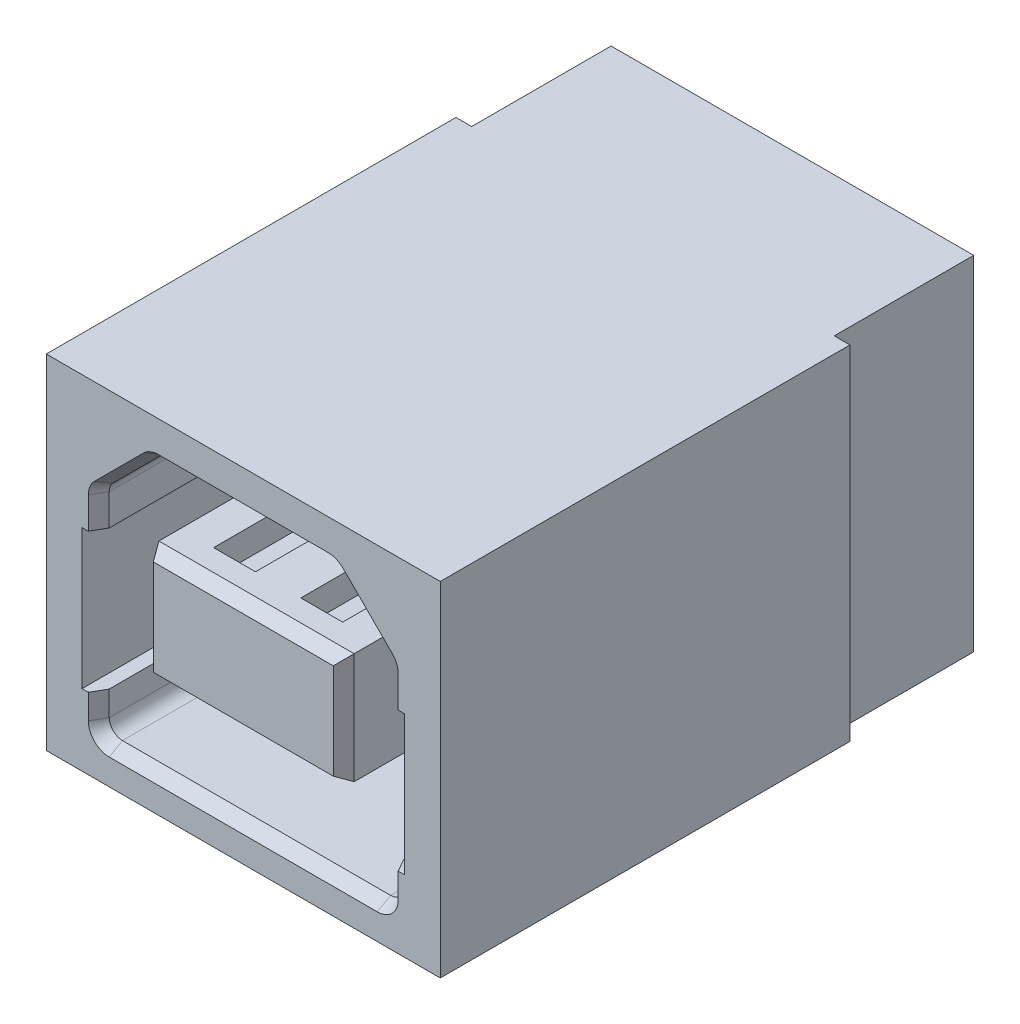
from build123d import *
from OCP.BRepFilletAPI import BRepFilletAPI_MakeChamfer

# Parameters (mm, degrees)
SKETCH1_W           = 11.3
SKETCH1_H           = 9.85
BOSS_EXTRUDE1_DEPTH = 15.75
SKETCH2_W           = 0.45
SKETCH2_H           = 4
CUT_EXTRUDE1_DEPTH  = 15.75
SKETCH3_W           = 5.6
SKETCH3_H           = 3.18
CUT_EXTRUDE2_DEPTH  = 8.38
CHAMFER1_SIZE       = 0.38
CHAMFER1_SIZE2      = 0.219393102
CHAMFER2_SIZE       = 0.38
CHAMFER2_SIZE2      = 0.219393102
SKETCH4_W           = 1
SKETCH4_H           = 10.13
SKETCH4_H_2         = 8.63
BOSS_EXTRUDE2_DEPTH = 0.83
SKETCH5_W           = 1.2
SKETCH5_H           = 0.75
CUT_EXTRUDE3_DEPTH  = 19.829431749
SKETCH6_W           = 1.2
SKETCH6_H           = 6.44
CUT_EXTRUDE4_DEPTH  = 1.29
CUT_EXTRUDE5_DEPTH  = 2


with BuildPart() as part:
    # Sketch1 → Boss-Extrude1 (new body)
    with BuildSketch(Plane.XY.offset(-0.38)):
        with Locations((0, 5.325)):
            Rectangle(SKETCH1_W, SKETCH1_H)
    extrude(amount=-BOSS_EXTRUDE1_DEPTH)

    # Sketch2 → Cut-Extrude1 (cut)
    with BuildSketch(Plane(origin=(0, 10.25, 0), x_dir=(1, 0, 0), z_dir=(0, 1, 0))):
        with Locations((-5.425, 14.13)):
            Rectangle(SKETCH2_W, SKETCH2_H)
        with Locations((5.425, 14.13)):
            Rectangle(SKETCH2_W, SKETCH2_H)
    extrude(amount=-CUT_EXTRUDE1_DEPTH, mode=Mode.SUBTRACT)

    # Sketch3 → Cut-Extrude2 (cut)
    with BuildSketch(Plane.XY.offset(-0.38)):
        with BuildLine():
            Line((-4.225, 7.352598846), (-4.225, 6.45))
            Line((-4.225, 6.45), (-4.625, 6.45))
            Line((-4.625, 6.45), (-4.625, 2.45))
            Line((-4.625, 2.45), (-4.225, 2.45))
            Line((-4.225, 2.45), (-4.225, 1.74))
            ThreePointArc((-4.225, 1.74), (-4.113700577, 1.471299423), (-3.845, 1.36))
            Line((-3.845, 1.36), (3.845, 1.36))
            ThreePointArc((3.845, 1.36), (4.113700577, 1.471299423), (4.225, 1.74))
            Line((4.225, 1.74), (4.225, 2.45))
            Line((4.225, 2.45), (4.625, 2.45))
            Line((4.625, 2.45), (4.625, 6.45))
            Line((4.625, 6.45), (4.225, 6.45))
            Line((4.225, 6.45), (4.225, 7.352598846))
            ThreePointArc((4.225, 7.352598846), (4.196074222, 7.498018551), (4.113700577, 7.621299423))
            Line((4.113700577, 7.621299423), (2.706299423, 9.028700577))
            ThreePointArc((2.706299423, 9.028700577), (2.583018551, 9.111074222), (2.437598846, 9.14))
            Line((2.437598846, 9.14), (-2.437598846, 9.14))
            ThreePointArc((-2.437598846, 9.14), (-2.583018551, 9.111074222), (-2.706299423, 9.028700577))
            Line((-2.706299423, 9.028700577), (-4.113700577, 7.621299423))
            ThreePointArc((-4.113700577, 7.621299423), (-4.196074222, 7.498018551), (-4.225, 7.352598846))
        make_face()
        with Locations((0, 5.25)):
            Rectangle(SKETCH3_W, SKETCH3_H, mode=Mode.SUBTRACT)
    extrude(amount=-CUT_EXTRUDE2_DEPTH, mode=Mode.SUBTRACT)

    # Chamfer1: one chamfer whose edges measure the first distance from different faces: ONE call of the kernel's chamfer builder (chamfer() names one face for all edges)
    chamfer1_edges_1 = [part.edges().sort_by_distance(p)[0] for p in [
        (0, 3.66, -0.38),
    ]]
    chamfer1_side_1 = [part.faces().sort_by_distance(p)[0] for p in [
        (0, 3.66, -4.57),
    ]]
    chamfer1_edges_2 = [part.edges().sort_by_distance(p)[0] for p in [
        (2.8, 5.25, -0.38),
    ]]
    chamfer1_side_2 = [part.faces().sort_by_distance(p)[0] for p in [
        (2.8, 5.25, -4.57),
    ]]
    chamfer1_edges_3 = [part.edges().sort_by_distance(p)[0] for p in [
        (0, 6.84, -0.38),
    ]]
    chamfer1_side_3 = [part.faces().sort_by_distance(p)[0] for p in [
        (0, 6.84, -4.57),
    ]]
    chamfer1_edges_4 = [part.edges().sort_by_distance(p)[0] for p in [
        (-2.8, 5.25, -0.38),
    ]]
    chamfer1_side_4 = [part.faces().sort_by_distance(p)[0] for p in [
        (-2.8, 5.25, -4.57),
    ]]
    chamfer1 = BRepFilletAPI_MakeChamfer(part.part.solid().wrapped)
    for e in chamfer1_edges_1:
        chamfer1.Add(CHAMFER1_SIZE, CHAMFER1_SIZE2, e.wrapped, chamfer1_side_1[0].wrapped)  # the first distance lies on this face
    for e in chamfer1_edges_2:
        chamfer1.Add(CHAMFER1_SIZE, CHAMFER1_SIZE2, e.wrapped, chamfer1_side_2[0].wrapped)  # the first distance lies on this face
    for e in chamfer1_edges_3:
        chamfer1.Add(CHAMFER1_SIZE, CHAMFER1_SIZE2, e.wrapped, chamfer1_side_3[0].wrapped)  # the first distance lies on this face
    for e in chamfer1_edges_4:
        chamfer1.Add(CHAMFER1_SIZE, CHAMFER1_SIZE2, e.wrapped, chamfer1_side_4[0].wrapped)  # the first distance lies on this face
    add(Compound.cast(chamfer1.Shape()), mode=Mode.REPLACE)

    # Chamfer2: one chamfer whose edges measure the first distance from different faces: ONE call of the kernel's chamfer builder (chamfer() names one face for all edges)
    chamfer2_edges_1 = [part.edges().sort_by_distance(p)[0] for p in [
        (4.225, 2.095, -0.38),
    ]]
    chamfer2_side_1 = [part.faces().sort_by_distance(p)[0] for p in [
        (4.225, 2.095, -4.57),
    ]]
    chamfer2_edges_2 = [part.edges().sort_by_distance(p)[0] for p in [
        (4.113700577, 1.471299423, -0.38),
    ]]
    chamfer2_side_2 = [part.faces().sort_by_distance(p)[0] for p in [
        (4.113700577, 1.471299423, -4.57),
    ]]
    chamfer2_edges_3 = [part.edges().sort_by_distance(p)[0] for p in [
        (0, 1.36, -0.38),
    ]]
    chamfer2_side_3 = [part.faces().sort_by_distance(p)[0] for p in [
        (0, 1.36, -4.57),
    ]]
    chamfer2_edges_4 = [part.edges().sort_by_distance(p)[0] for p in [
        (-4.113700577, 1.471299423, -0.38),
    ]]
    chamfer2_side_4 = [part.faces().sort_by_distance(p)[0] for p in [
        (-4.113700577, 1.471299423, -4.57),
    ]]
    chamfer2_edges_5 = [part.edges().sort_by_distance(p)[0] for p in [
        (-4.225, 2.095, -0.38),
    ]]
    chamfer2_side_5 = [part.faces().sort_by_distance(p)[0] for p in [
        (-4.225, 2.095, -4.57),
    ]]
    chamfer2_edges_6 = [part.edges().sort_by_distance(p)[0] for p in [
        (4.225, 6.901299423, -0.38),
    ]]
    chamfer2_side_6 = [part.faces().sort_by_distance(p)[0] for p in [
        (4.225, 6.901299423, -4.57),
    ]]
    chamfer2_edges_7 = [part.edges().sort_by_distance(p)[0] for p in [
        (4.196074222, 7.498018551, -0.38),
    ]]
    chamfer2_side_7 = [part.faces().sort_by_distance(p)[0] for p in [
        (4.196074222, 7.498018551, -4.57),
    ]]
    chamfer2_edges_8 = [part.edges().sort_by_distance(p)[0] for p in [
        (3.41, 8.325, -0.38),
    ]]
    chamfer2_side_8 = [part.faces().sort_by_distance(p)[0] for p in [
        (3.41, 8.325, -4.57),
    ]]
    chamfer2_edges_9 = [part.edges().sort_by_distance(p)[0] for p in [
        (2.583018551, 9.111074222, -0.38),
    ]]
    chamfer2_side_9 = [part.faces().sort_by_distance(p)[0] for p in [
        (2.583018551, 9.111074222, -4.57),
    ]]
    chamfer2_edges_10 = [part.edges().sort_by_distance(p)[0] for p in [
        (0, 9.14, -0.38),
    ]]
    chamfer2_side_10 = [part.faces().sort_by_distance(p)[0] for p in [
        (0, 9.14, -4.57),
    ]]
    chamfer2_edges_11 = [part.edges().sort_by_distance(p)[0] for p in [
        (-2.583018551, 9.111074222, -0.38),
    ]]
    chamfer2_side_11 = [part.faces().sort_by_distance(p)[0] for p in [
        (-2.583018551, 9.111074222, -4.57),
    ]]
    chamfer2_edges_12 = [part.edges().sort_by_distance(p)[0] for p in [
        (-3.41, 8.325, -0.38),
    ]]
    chamfer2_side_12 = [part.faces().sort_by_distance(p)[0] for p in [
        (-3.41, 8.325, -4.57),
    ]]
    chamfer2_edges_13 = [part.edges().sort_by_distance(p)[0] for p in [
        (-4.196074222, 7.498018551, -0.38),
    ]]
    chamfer2_side_13 = [part.faces().sort_by_distance(p)[0] for p in [
        (-4.196074222, 7.498018551, -4.57),
    ]]
    chamfer2_edges_14 = [part.edges().sort_by_distance(p)[0] for p in [
        (-4.225, 6.901299423, -0.38),
    ]]
    chamfer2_side_14 = [part.faces().sort_by_distance(p)[0] for p in [
        (-4.225, 6.901299423, -4.57),
    ]]
    chamfer2 = BRepFilletAPI_MakeChamfer(part.part.solid().wrapped)
    for e in chamfer2_edges_1:
        chamfer2.Add(CHAMFER2_SIZE, CHAMFER2_SIZE2, e.wrapped, chamfer2_side_1[0].wrapped)  # the first distance lies on this face
    for e in chamfer2_edges_2:
        chamfer2.Add(CHAMFER2_SIZE, CHAMFER2_SIZE2, e.wrapped, chamfer2_side_2[0].wrapped)  # the first distance lies on this face
    for e in chamfer2_edges_3:
        chamfer2.Add(CHAMFER2_SIZE, CHAMFER2_SIZE2, e.wrapped, chamfer2_side_3[0].wrapped)  # the first distance lies on this face
    for e in chamfer2_edges_4:
        chamfer2.Add(CHAMFER2_SIZE, CHAMFER2_SIZE2, e.wrapped, chamfer2_side_4[0].wrapped)  # the first distance lies on this face
    for e in chamfer2_edges_5:
        chamfer2.Add(CHAMFER2_SIZE, CHAMFER2_SIZE2, e.wrapped, chamfer2_side_5[0].wrapped)  # the first distance lies on this face
    for e in chamfer2_edges_6:
        chamfer2.Add(CHAMFER2_SIZE, CHAMFER2_SIZE2, e.wrapped, chamfer2_side_6[0].wrapped)  # the first distance lies on this face
    for e in chamfer2_edges_7:
        chamfer2.Add(CHAMFER2_SIZE, CHAMFER2_SIZE2, e.wrapped, chamfer2_side_7[0].wrapped)  # the first distance lies on this face
    for e in chamfer2_edges_8:
        chamfer2.Add(CHAMFER2_SIZE, CHAMFER2_SIZE2, e.wrapped, chamfer2_side_8[0].wrapped)  # the first distance lies on this face
    for e in chamfer2_edges_9:
        chamfer2.Add(CHAMFER2_SIZE, CHAMFER2_SIZE2, e.wrapped, chamfer2_side_9[0].wrapped)  # the first distance lies on this face
    for e in chamfer2_edges_10:
        chamfer2.Add(CHAMFER2_SIZE, CHAMFER2_SIZE2, e.wrapped, chamfer2_side_10[0].wrapped)  # the first distance lies on this face
    for e in chamfer2_edges_11:
        chamfer2.Add(CHAMFER2_SIZE, CHAMFER2_SIZE2, e.wrapped, chamfer2_side_11[0].wrapped)  # the first distance lies on this face
    for e in chamfer2_edges_12:
        chamfer2.Add(CHAMFER2_SIZE, CHAMFER2_SIZE2, e.wrapped, chamfer2_side_12[0].wrapped)  # the first distance lies on this face
    for e in chamfer2_edges_13:
        chamfer2.Add(CHAMFER2_SIZE, CHAMFER2_SIZE2, e.wrapped, chamfer2_side_13[0].wrapped)  # the first distance lies on this face
    for e in chamfer2_edges_14:
        chamfer2.Add(CHAMFER2_SIZE, CHAMFER2_SIZE2, e.wrapped, chamfer2_side_14[0].wrapped)  # the first distance lies on this face
    add(Compound.cast(chamfer2.Shape()), mode=Mode.REPLACE)

    # Sketch4 → Boss-Extrude2 (add)
    with BuildSketch(Plane(origin=(0, 0.4, 0), x_dir=(-1, 0, 0), z_dir=(0, -1, 0))):
        with Locations((3.75, 11.065)):
            Rectangle(SKETCH4_W, SKETCH4_H)
        with Locations((0, 11.815)):
            Rectangle(SKETCH4_W, SKETCH4_H_2)
        with Locations((-3.75, 11.065)):
            Rectangle(SKETCH4_W, SKETCH4_H)
    extrude(amount=BOSS_EXTRUDE2_DEPTH)

    # Sketch5 → Cut-Extrude3 (cut, through all)
    with BuildSketch(Plane.XY.offset(-1.38)):
        with Locations((-1.25, 6.465)):
            Rectangle(SKETCH5_W, SKETCH5_H)
        with Locations((1.25, 6.465)):
            Rectangle(SKETCH5_W, SKETCH5_H)
        with Locations((1.25, 4.035)):
            Rectangle(SKETCH5_W, SKETCH5_H)
        with Locations((-1.25, 4.035)):
            Rectangle(SKETCH5_W, SKETCH5_H)
    extrude(amount=-CUT_EXTRUDE3_DEPTH, mode=Mode.SUBTRACT)

    # Sketch6 → Cut-Extrude4 (cut)
    with BuildSketch(Plane(origin=(0, 0, -16.13), x_dir=(-1, 0, 0), z_dir=(0, 0, -1))):
        with Locations((-1.25, 3.62)):
            Rectangle(SKETCH6_W, SKETCH6_H)
        with Locations((1.25, 3.62)):
            Rectangle(SKETCH6_W, SKETCH6_H)
    extrude(amount=-CUT_EXTRUDE4_DEPTH, mode=Mode.SUBTRACT)

    # Sketch7 → Cut-Extrude5 (cut)
    with BuildSketch(Plane(origin=(0, 0, -14.84), x_dir=(-1, 0, 0), z_dir=(0, 0, -1))):
        Polygon((-1.55, 2.66), (-1.55, 0), (-0.95, 0), (-0.95, 2.66), (-0.65, 2.66), (-0.65, 4.41), (-1.85, 4.41), (-1.85, 2.66), align=None)
        Polygon((0.95, 2.66), (0.95, 0), (1.55, 0), (1.55, 2.66), (1.85, 2.66), (1.85, 4.41), (0.65, 4.41), (0.65, 2.66), align=None)
    extrude(amount=-CUT_EXTRUDE5_DEPTH, mode=Mode.SUBTRACT)


solid = part.part
